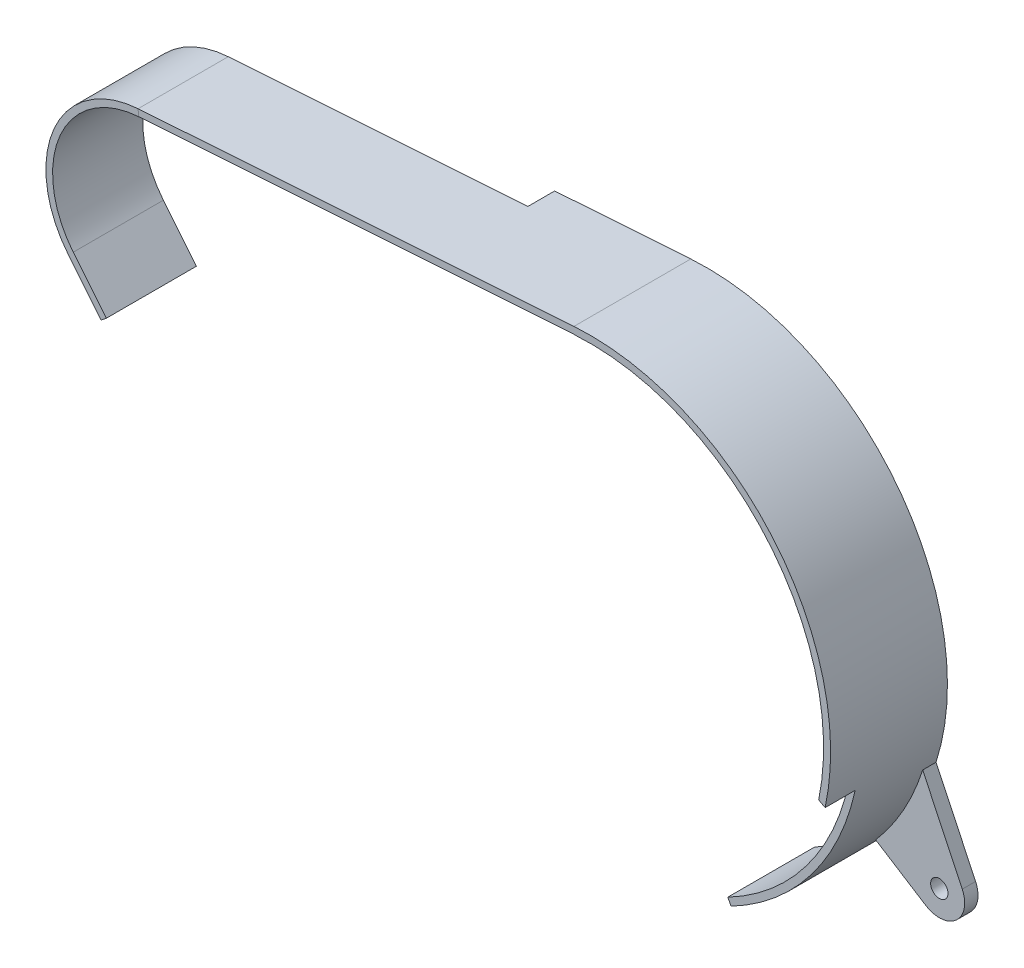
from build123d import *
from OCP.BRepAlgoAPI import BRepAlgoAPI_Cut
from OCP.TopTools import TopTools_ListOfShape

# Parameters (mm, degrees)
EXTRUDE_THIN1_DEPTH = 22.224999999999998
EXTRUDE_THIN2_DEPTH = 22.224999999999998
EXTRUDE_THIN3_DEPTH = 22.224999999999998
CUT_EXTRUDE2_DEPTH  = 11.43
SKETCH11_R          = 3.3020000000000405
BOSS_EXTRUDE1_DEPTH = 5.08
CUT_EXTRUDE5_DEPTH  = 303.7454642008095
BOSS_EXTRUDE5_DEPTH = 44.45
CUT_EXTRUDE7_DEPTH  = 320.7810072191918


with BuildPart() as part:
    # Sketch1 → Extrude-Thin1 (new, symmetric)
    with BuildSketch(Plane.XY):
        with BuildLine():
            ThreePointArc((-2.331833528473019, 34.974351407788646), (-33.41280778757034, 10.593723601778466), (-22.057728390521078, -27.2415))
            Line((-22.057728390521078, -27.2415), (-23.65611450577623, -29.215521739130434))
            ThreePointArc((-23.65611450577623, -29.215521739130434), (-35.83402574319137, 11.361384732342133), (-2.500806972565267, 37.50872469820812))
            Line((-2.500806972565267, 37.50872469820812), (-2.331833528473019, 34.974351407788646))
        make_face()
    extrude(amount=EXTRUDE_THIN1_DEPTH, both=True)

    # Sketch17 → Cut-Extrude5 (cut, through all)
    with BuildSketch(Plane.XY.offset(22.224999999999998)):
        with BuildLine():
            Line((-29.159882495618955, -23.724664736128418), (-27.18962016483388, -22.121646848552164))
            Line((-27.18962016483388, -22.121646848552164), (-22.057728390521085, -27.24149999999998))
            Line((-22.057728390521085, -27.24149999999998), (-23.65611450577624, -29.215521739130416))
            ThreePointArc((-23.65611450577624, -29.215521739130416), (-26.550325091601046, -26.6127544897235), (-29.159882495618955, -23.724664736128418))
        make_face()
    extrude(amount=-CUT_EXTRUDE5_DEPTH, mode=Mode.SUBTRACT)

    # Sketch18 → Boss-Extrude5 (add, through all)
    with BuildSketch(Plane.XY.offset(22.224999999999998)):
        with BuildLine():
            Line((-29.159882495618955, -23.724664736128418), (-16.57310537390898, -39.19501788757624))
            Line((-16.57310537390898, -39.19501788757624), (-14.602843043123915, -37.59199999999999))
            Line((-14.602843043123915, -37.59199999999999), (-27.18962016483388, -22.121646848552164))
            ThreePointArc((-27.18962016483388, -22.121646848552164), (-32.138253083569026, 13.99197601257467), (-2.3318335284730156, 34.97435140778865))
            Line((-2.3318335284730156, 34.97435140778865), (-2.5008069725652633, 37.50872469820813))
            ThreePointArc((-2.5008069725652633, 37.50872469820813), (-34.46711200266824, 15.005887317833707), (-29.159882495618955, -23.724664736128418))
        make_face()
    extrude(amount=-BOSS_EXTRUDE5_DEPTH)


with BuildPart() as body_2:
    # Sketch2 → Extrude-Thin2 (new, symmetric)
    with BuildSketch(Plane.XY):
        with BuildLine():
            ThreePointArc((210.44489740889506, -121.53899999999999), (255.02266889982377, -18.69178601947969), (163.5039294567713, 46.031065164681365))
            Line((163.5039294567713, 46.031065164681365), (163.32650734047442, 48.69215711962181))
            ThreePointArc((163.32650734047442, 48.69215711962181), (257.5908089668185, -17.972379600064077), (211.6757043311619, -123.90500999999999))
            Line((211.6757043311619, -123.90500999999999), (210.44489740889506, -121.53899999999999))
        make_face()
    extrude(amount=EXTRUDE_THIN2_DEPTH, both=True)

    # Sketch4 → Extrude-Thin3 (add, symmetric)
    with BuildSketch(Plane.XY):
        Polygon((-2.5008069725652633, 37.50872469820813), (163.3265073404744, 48.69215711962182), (163.4974173036775, 46.157913685285266), (-2.329897009362141, 34.974481263871574), align=None)
    extrude(amount=EXTRUDE_THIN3_DEPTH, both=True)

    # Sketch9 → Cut-Extrude2 (cut)
    with BuildSketch(Plane.XY.offset(22.224999999999998)):
        with BuildLine():
            Line((210.44489740889503, -121.53899999999999), (211.6757043311619, -123.90501))
            ThreePointArc((211.6757043311619, -123.90501), (242.1722048894427, -98.27183057442694), (258.8971357878048, -62.11421560593305))
            Line((258.8971357878048, -62.11421560593305), (256.45118461979064, -60.79476951620356))
            ThreePointArc((256.45118461979064, -60.79476951620356), (240.28626889776245, -96.34600174604482), (210.44489740889503, -121.53899999999999))
        make_face()
    extrude(amount=-CUT_EXTRUDE2_DEPTH, mode=Mode.SUBTRACT)

    # Sketch11 → Boss-Extrude1 (add)
    with BuildSketch(Plane(origin=(0, 0, -22.224999999999998), x_dir=(-1, 0, 0), z_dir=(0, 0, -1))):
        with BuildLine():
            Line((-271.69936572083293, -102.24607705891748), (-256.65524104314295, -70.49607705891748))
            ThreePointArc((-256.65524104314295, -70.49607705891748), (-249.32472481112566, -87.38699545967683), (-238.76306857281796, -102.46980057519824))
            Line((-238.76306857281796, -102.46980057519824), (-257.813068572818, -114.53346259368794))
            ThreePointArc((-257.813068572818, -114.53346259368794), (-269.373124822864, -113.60745846421521), (-271.69936572083293, -102.24607705891748))
        make_face()
        with Locations((-262.9769824854714, -106.37901000000001)):
            Circle(SKETCH11_R, mode=Mode.SUBTRACT)
    extrude(amount=-BOSS_EXTRUDE1_DEPTH)


with BuildPart() as cut_extrude7_tool:
    # Sketch19 → Cut-Extrude7 (new, through all)
    with BuildSketch(Plane(origin=(-2.529466716951779, 37.50679187841974, 0), x_dir=(0.9977336355655706, 0.06728738708784333, 0), z_dir=(-0.06728738708784333, 0.9977336355655706, 0))):
        Polygon((-37.591999999999985, 22.224999999999998), (114.3287248453544, 22.224999999999998), (114.32872484535442, 12.064999999999998), (-37.591999999999985, 12.064999999999998), align=None)
    extrude(amount=-CUT_EXTRUDE7_DEPTH)


with BuildPart() as part_1:
    add(part.part)

    # Cut-Extrude7: cut by cut_extrude7_tool, with a tolerance
    cut_extrude7_stock = TopTools_ListOfShape()
    cut_extrude7_stock.Append(part_1.part.wrapped)
    cut_extrude7_tools = TopTools_ListOfShape()
    cut_extrude7_tools.Append(cut_extrude7_tool.part.wrapped)
    cut_extrude7_cut = BRepAlgoAPI_Cut()
    cut_extrude7_cut.SetArguments(cut_extrude7_stock)
    cut_extrude7_cut.SetTools(cut_extrude7_tools)
    cut_extrude7_cut.SetFuzzyValue(0.00001)
    cut_extrude7_cut.Build()
    add(Compound.cast(cut_extrude7_cut.Shape()).solids(), mode=Mode.REPLACE)


with BuildPart() as body_2_1:
    add(body_2.part)

    # Cut-Extrude7: cut by cut_extrude7_tool, with a tolerance
    cut_extrude7_2_stock = TopTools_ListOfShape()
    cut_extrude7_2_stock.Append(body_2_1.part.wrapped)
    cut_extrude7_2_tools = TopTools_ListOfShape()
    cut_extrude7_2_tools.Append(cut_extrude7_tool.part.wrapped)
    cut_extrude7_2_cut = BRepAlgoAPI_Cut()
    cut_extrude7_2_cut.SetArguments(cut_extrude7_2_stock)
    cut_extrude7_2_cut.SetTools(cut_extrude7_2_tools)
    cut_extrude7_2_cut.SetFuzzyValue(0.00001)
    cut_extrude7_2_cut.Build()
    add(Compound.cast(cut_extrude7_2_cut.Shape()).solids(), mode=Mode.REPLACE)


solid = Compound([part_1.part, body_2_1.part])
